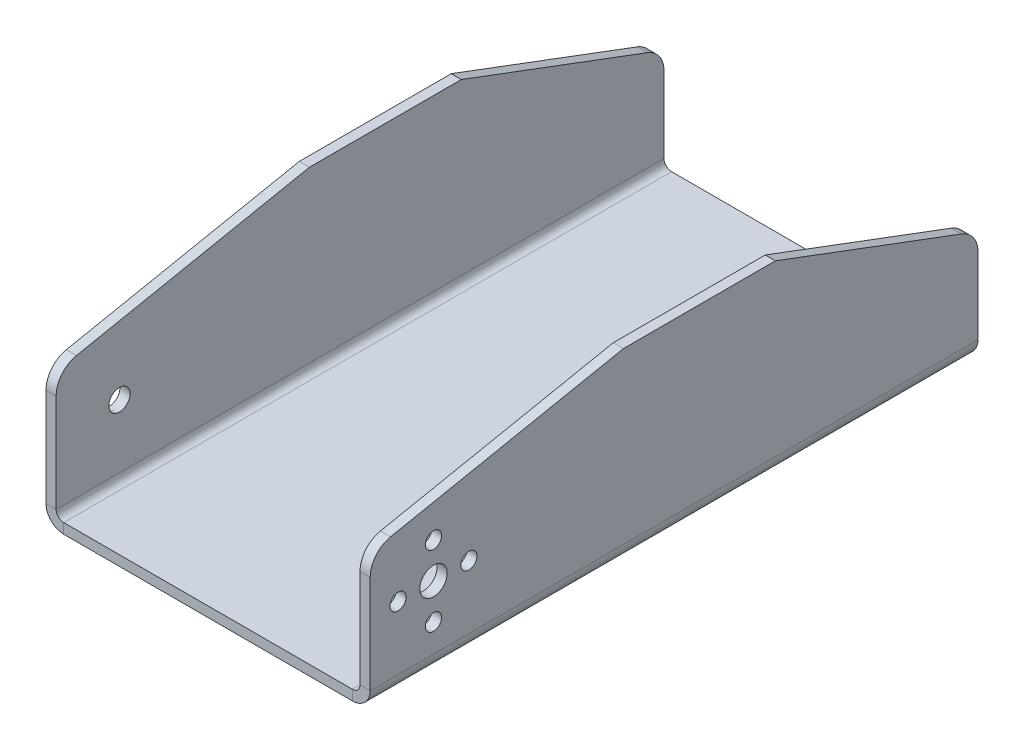
from build123d import *
from OCP.BRepFilletAPI import BRepFilletAPI_MakeChamfer

# Parameters (mm, degrees)
SM_BASE_FLANGE_1_DEPTH = 120
CUT_EXTRUDE_1_REACH    = 139.391
SKETCH_6_R             = 1.6
CHAMFER_1_SIZE         = 10
CHAMFER_1_SIZE2        = 50
SKETCH_7_R             = 2.7
CUT_EXTRUDE_2_DEPTH    = 2
SKETCH_9_R             = 2.1
CUT_EXTRUDE_3_DEPTH    = 2
CHAMFER_2_SIZE         = 40
CHAMFER_2_SIZE2        = 15
FILLET_1_R             = 5


# Sheet-metal steps are written as plain solids
with BuildPart() as part:
    # Sketch 1 → 基材-凸緣1 (new body)
    with BuildSketch(Plane.XY):
        with BuildLine():
            Line((-30, 17.5), (-30, -16))
            ThreePointArc((-30, -16), (-29.560660172, -17.060660172), (-28.5, -17.5))
            Line((-28.5, -17.5), (28.5, -17.5))
            ThreePointArc((28.5, -17.5), (29.560660172, -17.060660172), (30, -16))
            Line((30, -16), (30, 17.5))
            Line((30, 17.5), (32, 17.5))
            Line((32, 17.5), (32, -16))
            ThreePointArc((32, -16), (30.974873734, -18.474873734), (28.5, -19.5))
            Line((28.5, -19.5), (-28.5, -19.5))
            ThreePointArc((-28.5, -19.5), (-30.974873734, -18.474873734), (-32, -16))
            Line((-32, -16), (-32, 17.5))
            Line((-32, 17.5), (-30, 17.5))
        make_face()
    extrude(amount=SM_BASE_FLANGE_1_DEPTH)

    # 草圖6 → 除料-伸長1 (cut, up to next)
    with BuildSketch(Plane(origin=(32, 0, 0), x_dir=(0, 0, -1), z_dir=(1, 0, 0)), mode=Mode.PRIVATE) as cut_extrude_1_sk1:
        with Locations(Location((-107.5, 3.5, 0), (0, 0, 90))):
            Circle(SKETCH_6_R)
    cut_extrude_1_tool1 = extrude(cut_extrude_1_sk1.sketch, amount=-CUT_EXTRUDE_1_REACH, mode=Mode.PRIVATE) & part.part
    # 草圖6 → 除料-伸長1 (cut, up to next)
    with BuildSketch(Plane(origin=(32, 0, 0), x_dir=(0, 0, -1), z_dir=(1, 0, 0)), mode=Mode.PRIVATE) as cut_extrude_1_sk2:
        with Locations(Location((-100.5, -3.5, 0), (0, 0, 90))):
            Circle(SKETCH_6_R)
    cut_extrude_1_tool2 = extrude(cut_extrude_1_sk2.sketch, amount=-CUT_EXTRUDE_1_REACH, mode=Mode.PRIVATE) & part.part
    # 草圖6 → 除料-伸長1 (cut, up to next)
    with BuildSketch(Plane(origin=(32, 0, 0), x_dir=(0, 0, -1), z_dir=(1, 0, 0)), mode=Mode.PRIVATE) as cut_extrude_1_sk3:
        with Locations(Location((-107.5, -10.5, 0), (0, 0, 90))):
            Circle(SKETCH_6_R)
    cut_extrude_1_tool3 = extrude(cut_extrude_1_sk3.sketch, amount=-CUT_EXTRUDE_1_REACH, mode=Mode.PRIVATE) & part.part
    # 草圖6 → 除料-伸長1 (cut, up to next)
    with BuildSketch(Plane(origin=(32, 0, 0), x_dir=(0, 0, -1), z_dir=(1, 0, 0)), mode=Mode.PRIVATE) as cut_extrude_1_sk4:
        with Locations(Location((-114.5, -3.5, 0), (0, 0, 90))):
            Circle(SKETCH_6_R)
    cut_extrude_1_tool4 = extrude(cut_extrude_1_sk4.sketch, amount=-CUT_EXTRUDE_1_REACH, mode=Mode.PRIVATE) & part.part
    add(cut_extrude_1_tool1.solids().sort_by_distance((32, 3.5, 107.5))[0], mode=Mode.SUBTRACT)
    add(cut_extrude_1_tool2.solids().sort_by_distance((32, -3.5, 100.5))[0], mode=Mode.SUBTRACT)
    add(cut_extrude_1_tool3.solids().sort_by_distance((32, -10.5, 107.5))[0], mode=Mode.SUBTRACT)
    add(cut_extrude_1_tool4.solids().sort_by_distance((32, -3.5, 114.5))[0], mode=Mode.SUBTRACT)

    # 導角1
    chamfer_1_edges = [part.edges().sort_by_distance(p)[0] for p in [
        (-31, 17.5, 120),
        (31, 17.5, 120),
    ]]
    chamfer_1_side = [part.faces().sort_by_distance(p)[0] for p in [
        (-30.452140533, -17.952140533, 120),
    ]]
    chamfer(chamfer_1_edges, length=CHAMFER_1_SIZE, length2=CHAMFER_1_SIZE2, reference=chamfer_1_side[0])

    # 草圖7 → 除料-伸長2 (cut)
    with BuildSketch(Plane(origin=(32, 0, 0), x_dir=(0, 0, -1), z_dir=(1, 0, 0))):
        with Locations(Location((-107.5, -3.5, 0), (0, 0, 90))):
            Circle(SKETCH_7_R)
    extrude(amount=-CUT_EXTRUDE_2_DEPTH, mode=Mode.SUBTRACT)

    # 草圖9 → 除料-伸長3 (cut)
    with BuildSketch(Plane.ZY.offset(32)):
        with Locations(Location((107.5, -3.5, 0), (0, 0, 270))):
            Circle(SKETCH_9_R)
    extrude(amount=-CUT_EXTRUDE_3_DEPTH, mode=Mode.SUBTRACT)

    # 導角2: one chamfer whose edges measure the first distance from different faces: ONE call of the kernel's chamfer builder (chamfer() names one face for all edges)
    chamfer_2_edges_1 = [part.edges().sort_by_distance(p)[0] for p in [
        (-31, 17.5, 0),
    ]]
    chamfer_2_side_1 = [part.faces().sort_by_distance(p)[0] for p in [
        (-31, 17.5, 35),
    ]]
    chamfer_2_edges_2 = [part.edges().sort_by_distance(p)[0] for p in [
        (31, 17.5, 0),
    ]]
    chamfer_2_side_2 = [part.faces().sort_by_distance(p)[0] for p in [
        (31, 17.5, 35),
    ]]
    chamfer_2 = BRepFilletAPI_MakeChamfer(part.part.solid().wrapped)
    for e in chamfer_2_edges_1:
        chamfer_2.Add(CHAMFER_2_SIZE, CHAMFER_2_SIZE2, e.wrapped, chamfer_2_side_1[0].wrapped)  # the first distance lies on this face
    for e in chamfer_2_edges_2:
        chamfer_2.Add(CHAMFER_2_SIZE, CHAMFER_2_SIZE2, e.wrapped, chamfer_2_side_2[0].wrapped)  # the first distance lies on this face
    add(Compound.cast(chamfer_2.Shape()), mode=Mode.REPLACE)

    # 圓角1
    fillet_1_edges = [part.edges().sort_by_distance(p)[0] for p in [
        (-31, 2.5, 0),
        (31, 2.5, 0),
        (-31, 7.5, 120),
        (31, 7.5, 120),
    ]]
    fillet(fillet_1_edges, radius=FILLET_1_R)


solid = part.part
